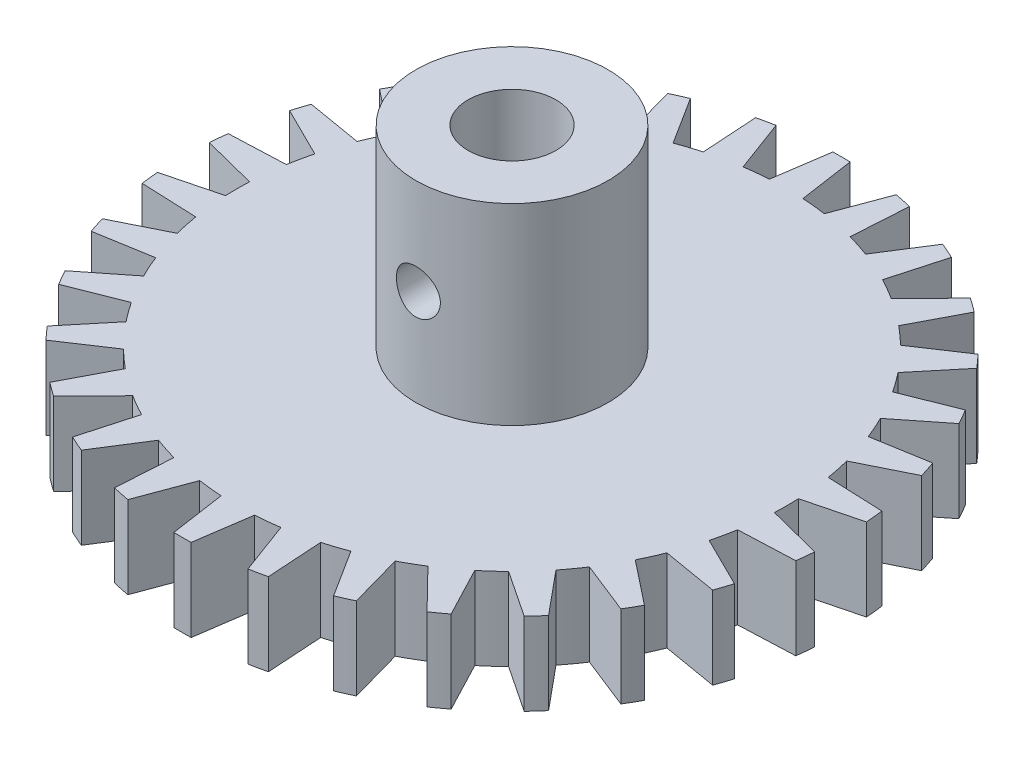
from build123d import *

# Parameters (mm, degrees)
BOSS_EXTRUDE1_DEPTH     = 3
SKETCH3_R               = 3.5
BOSS_EXTRUDE2_DEPTH     = 7
CUT_EXTRUDE1_DEPTH      = 19.333400135
CUT_EXTRUDE1_DEPTH_BACK = 19.333400135
SKETCH2_R               = 1.6
SKETCH4_R               = 0.8
CUT_EXTRUDE2_DEPTH      = 20.675201664


with BuildPart() as part:
    # Sketch1 → Boss-Extrude1 (new body)
    with BuildSketch(Plane(origin=(0, 0, 0), x_dir=(1, 0, 0), z_dir=(0, 1, 0))):
        with BuildLine():
            Line((-0.31412338, 11.9958879), (-0.610485395, 9.981347984))
            ThreePointArc((-0.610485395, 9.981347984), (-0.828082075, 9.965655025), (-1.045284633, 9.945218954))
            ThreePointArc((-1.045284633, 9.945218954), (-1.261989691, 9.920049497), (-1.478094111, 9.890158634))
            Line((-1.478094111, 9.890158634), (-2.186826306, 11.799058891))
            ThreePointArc((-2.186826306, 11.799058891), (-2.49494029, 11.737771209), (-2.801344366, 11.668439045))
            Line((-2.801344366, 11.668439045), (-2.672383761, 9.636304532))
            ThreePointArc((-2.672383761, 9.636304532), (-2.881962681, 9.575713608), (-3.090169944, 9.510565163))
            ThreePointArc((-3.090169944, 9.510565163), (-3.296906453, 9.440890204), (-3.502073813, 9.366721892))
            Line((-3.502073813, 9.366721892), (-4.592201188, 11.08655439))
            ThreePointArc((-4.592201188, 11.08655439), (-4.880839717, 10.962545492), (-5.166133162, 10.831023412))
            Line((-5.166133162, 10.831023412), (-4.617486132, 8.870108332))
            ThreePointArc((-4.617486132, 8.870108332), (-4.809887689, 8.767267557), (-5, 8.660254038))
            ThreePointArc((-5, 8.660254038), (-5.187732582, 8.549118707), (-5.372996083, 8.433914458))
            Line((-5.372996083, 8.433914458), (-6.796874843, 9.889514263))
            ThreePointArc((-6.796874843, 9.889514263), (-7.053423028, 9.708203932), (-7.305137148, 9.520240083))
            Line((-7.305137148, 9.520240083), (-6.360782203, 7.716245834))
            ThreePointArc((-6.360782203, 7.716245834), (-6.527597525, 7.575649844), (-6.691306064, 7.431448255))
            ThreePointArc((-6.691306064, 7.431448255), (-6.851829903, 7.283709699), (-7.009092643, 7.132504492))
            Line((-7.009092643, 7.132504492), (-8.704492452, 8.260254908))
            ThreePointArc((-8.704492452, 8.260254908), (-8.917737906, 8.029567276), (-9.124871587, 7.79337658))
            Line((-9.124871587, 7.79337658), (-7.826081569, 6.225146366))
            ThreePointArc((-7.826081569, 6.225146366), (-7.960020025, 6.05293988), (-8.090169944, 5.877852523))
            ThreePointArc((-8.090169944, 5.877852523), (-8.216469379, 5.699967626), (-8.338858221, 5.519369853))
            Line((-8.338858221, 5.519369853), (-10.231681972, 6.269982777))
            ThreePointArc((-10.231681972, 6.269982777), (-10.392304845, 6), (-10.545805352, 5.725905123))
            Line((-10.545805352, 5.725905123), (-8.949343616, 4.461978131))
            ThreePointArc((-8.949343616, 4.461978131), (-9.044551455, 4.265687399), (-9.135454576, 4.067366431))
            ThreePointArc((-9.135454576, 4.067366431), (-9.222009717, 3.867109616), (-9.30417568, 3.665012267))
            Line((-9.30417568, 3.665012267), (-11.311697893, 4.005682311))
            ThreePointArc((-11.311697893, 4.005682311), (-11.412678196, 3.708203932), (-11.505836818, 3.408184136))
            Line((-11.505836818, 3.408184136), (-9.681476404, 2.503800041))
            ThreePointArc((-9.681476404, 2.503800041), (-9.733792585, 2.292003909), (-9.781476007, 2.079116908))
            ThreePointArc((-9.781476007, 2.079116908), (-9.824503977, 1.86524036), (-9.862856015, 1.650476059))
            Line((-9.862856015, 1.650476059), (-11.897338336, 1.566314307))
            ThreePointArc((-11.897338336, 1.566314307), (-11.934262744, 1.254341559), (-11.963008005, 0.941509149))
            Line((-11.963008005, 0.941509149), (-9.990482216, 0.436193874))
            ThreePointArc((-9.990482216, 0.436193874), (-9.997620271, 0.21814885), (-10, 0))
            ThreePointArc((-10, 0), (-9.997620271, -0.21814885), (-9.990482216, -0.436193874))
            Line((-9.990482216, -0.436193874), (-11.963008005, -0.941509149))
            ThreePointArc((-11.963008005, -0.941509149), (-11.934262744, -1.254341559), (-11.897338336, -1.566314307))
            Line((-11.897338336, -1.566314307), (-9.862856015, -1.650476059))
            ThreePointArc((-9.862856015, -1.650476059), (-9.824503977, -1.86524036), (-9.781476007, -2.079116908))
            ThreePointArc((-9.781476007, -2.079116908), (-9.733792585, -2.292003909), (-9.681476404, -2.503800041))
            Line((-9.681476404, -2.503800041), (-11.505836818, -3.408184136))
            ThreePointArc((-11.505836818, -3.408184136), (-11.412678196, -3.708203932), (-11.311697893, -4.005682311))
            Line((-11.311697893, -4.005682311), (-9.30417568, -3.665012267))
            ThreePointArc((-9.30417568, -3.665012267), (-9.222009717, -3.867109616), (-9.135454576, -4.067366431))
            ThreePointArc((-9.135454576, -4.067366431), (-9.044551455, -4.265687399), (-8.949343616, -4.461978131))
            Line((-8.949343616, -4.461978131), (-10.545805352, -5.725905123))
            ThreePointArc((-10.545805352, -5.725905123), (-10.392304845, -6), (-10.231681972, -6.269982777))
            Line((-10.231681972, -6.269982777), (-8.338858221, -5.519369853))
            ThreePointArc((-8.338858221, -5.519369853), (-8.216469379, -5.699967626), (-8.090169944, -5.877852523))
            ThreePointArc((-8.090169944, -5.877852523), (-7.960020025, -6.05293988), (-7.826081569, -6.225146366))
            Line((-7.826081569, -6.225146366), (-9.124871587, -7.79337658))
            ThreePointArc((-9.124871587, -7.79337658), (-8.917737906, -8.029567276), (-8.704492452, -8.260254908))
            Line((-8.704492452, -8.260254908), (-7.009092643, -7.132504492))
            ThreePointArc((-7.009092643, -7.132504492), (-6.851829903, -7.283709699), (-6.691306064, -7.431448255))
            ThreePointArc((-6.691306064, -7.431448255), (-6.527597525, -7.575649844), (-6.360782203, -7.716245834))
            Line((-6.360782203, -7.716245834), (-7.305137148, -9.520240083))
            ThreePointArc((-7.305137148, -9.520240083), (-7.053423028, -9.708203932), (-6.796874843, -9.889514263))
            Line((-6.796874843, -9.889514263), (-5.372996083, -8.433914458))
            ThreePointArc((-5.372996083, -8.433914458), (-5.187732582, -8.549118707), (-5, -8.660254038))
            ThreePointArc((-5, -8.660254038), (-4.809887689, -8.767267557), (-4.617486132, -8.870108332))
            Line((-4.617486132, -8.870108332), (-5.166133162, -10.831023412))
            ThreePointArc((-5.166133162, -10.831023412), (-4.880839717, -10.962545492), (-4.592201188, -11.08655439))
            Line((-4.592201188, -11.08655439), (-3.502073813, -9.366721892))
            ThreePointArc((-3.502073813, -9.366721892), (-3.296906453, -9.440890204), (-3.090169944, -9.510565163))
            ThreePointArc((-3.090169944, -9.510565163), (-2.881962681, -9.575713608), (-2.672383761, -9.636304532))
            Line((-2.672383761, -9.636304532), (-2.801344366, -11.668439045))
            ThreePointArc((-2.801344366, -11.668439045), (-2.49494029, -11.737771209), (-2.186826306, -11.799058891))
            Line((-2.186826306, -11.799058891), (-1.478094111, -9.890158634))
            ThreePointArc((-1.478094111, -9.890158634), (-1.261989691, -9.920049497), (-1.045284633, -9.945218954))
            ThreePointArc((-1.045284633, -9.945218954), (-0.828082075, -9.965655025), (-0.610485395, -9.981347984))
            Line((-0.610485395, -9.981347984), (-0.31412338, -11.9958879))
            ThreePointArc((-0.31412338, -11.9958879), (0, -12), (0.31412338, -11.9958879))
            Line((0.31412338, -11.9958879), (0.610485395, -9.981347984))
            ThreePointArc((0.610485395, -9.981347984), (0.828082075, -9.965655025), (1.045284633, -9.945218954))
            ThreePointArc((1.045284633, -9.945218954), (1.261989691, -9.920049497), (1.478094111, -9.890158634))
            Line((1.478094111, -9.890158634), (2.186826306, -11.799058891))
            ThreePointArc((2.186826306, -11.799058891), (2.49494029, -11.737771209), (2.801344366, -11.668439045))
            Line((2.801344366, -11.668439045), (2.672383761, -9.636304532))
            ThreePointArc((2.672383761, -9.636304532), (2.881962681, -9.575713608), (3.090169944, -9.510565163))
            ThreePointArc((3.090169944, -9.510565163), (3.296906453, -9.440890204), (3.502073813, -9.366721892))
            Line((3.502073813, -9.366721892), (4.592201188, -11.08655439))
            ThreePointArc((4.592201188, -11.08655439), (4.880839717, -10.962545492), (5.166133162, -10.831023412))
            Line((5.166133162, -10.831023412), (4.617486132, -8.870108332))
            ThreePointArc((4.617486132, -8.870108332), (4.809887689, -8.767267557), (5, -8.660254038))
            ThreePointArc((5, -8.660254038), (5.187732582, -8.549118707), (5.372996083, -8.433914458))
            Line((5.372996083, -8.433914458), (6.796874843, -9.889514263))
            ThreePointArc((6.796874843, -9.889514263), (7.053423028, -9.708203932), (7.305137148, -9.520240083))
            Line((7.305137148, -9.520240083), (6.360782203, -7.716245834))
            ThreePointArc((6.360782203, -7.716245834), (6.527597525, -7.575649844), (6.691306064, -7.431448255))
            ThreePointArc((6.691306064, -7.431448255), (6.851829903, -7.283709699), (7.009092643, -7.132504492))
            Line((7.009092643, -7.132504492), (8.704492452, -8.260254908))
            ThreePointArc((8.704492452, -8.260254908), (8.917737906, -8.029567276), (9.124871587, -7.79337658))
            Line((9.124871587, -7.79337658), (7.826081569, -6.225146366))
            ThreePointArc((7.826081569, -6.225146366), (7.960020025, -6.05293988), (8.090169944, -5.877852523))
            ThreePointArc((8.090169944, -5.877852523), (8.216469379, -5.699967626), (8.338858221, -5.519369853))
            Line((8.338858221, -5.519369853), (10.231681972, -6.269982777))
            ThreePointArc((10.231681972, -6.269982777), (10.392304845, -6), (10.545805352, -5.725905123))
            Line((10.545805352, -5.725905123), (8.949343616, -4.461978131))
            ThreePointArc((8.949343616, -4.461978131), (9.044551455, -4.265687399), (9.135454576, -4.067366431))
            ThreePointArc((9.135454576, -4.067366431), (9.222009717, -3.867109616), (9.30417568, -3.665012267))
            Line((9.30417568, -3.665012267), (11.311697893, -4.005682311))
            ThreePointArc((11.311697893, -4.005682311), (11.412678196, -3.708203932), (11.505836818, -3.408184136))
            Line((11.505836818, -3.408184136), (9.681476404, -2.503800041))
            ThreePointArc((9.681476404, -2.503800041), (9.733792585, -2.292003909), (9.781476007, -2.079116908))
            ThreePointArc((9.781476007, -2.079116908), (9.824503977, -1.86524036), (9.862856015, -1.650476059))
            Line((9.862856015, -1.650476059), (11.897338336, -1.566314307))
            ThreePointArc((11.897338336, -1.566314307), (11.934262744, -1.254341559), (11.963008005, -0.941509149))
            Line((11.963008005, -0.941509149), (9.990482216, -0.436193874))
            ThreePointArc((9.990482216, -0.436193874), (9.997620271, -0.21814885), (10, 0))
            ThreePointArc((10, 0), (9.997620271, 0.21814885), (9.990482216, 0.436193874))
            Line((9.990482216, 0.436193874), (11.963008005, 0.941509149))
            ThreePointArc((11.963008005, 0.941509149), (11.934262744, 1.254341559), (11.897338336, 1.566314307))
            Line((11.897338336, 1.566314307), (9.862856015, 1.650476059))
            ThreePointArc((9.862856015, 1.650476059), (9.824503977, 1.86524036), (9.781476007, 2.079116908))
            ThreePointArc((9.781476007, 2.079116908), (9.733792585, 2.292003909), (9.681476404, 2.503800041))
            Line((9.681476404, 2.503800041), (11.505836818, 3.408184136))
            ThreePointArc((11.505836818, 3.408184136), (11.412678196, 3.708203932), (11.311697893, 4.005682311))
            Line((11.311697893, 4.005682311), (9.30417568, 3.665012267))
            ThreePointArc((9.30417568, 3.665012267), (9.222009717, 3.867109616), (9.135454576, 4.067366431))
            ThreePointArc((9.135454576, 4.067366431), (9.044551455, 4.265687399), (8.949343616, 4.461978131))
            Line((8.949343616, 4.461978131), (10.545805352, 5.725905123))
            ThreePointArc((10.545805352, 5.725905123), (10.392304845, 6), (10.231681972, 6.269982777))
            Line((10.231681972, 6.269982777), (8.338858221, 5.519369853))
            ThreePointArc((8.338858221, 5.519369853), (8.216469379, 5.699967626), (8.090169944, 5.877852523))
            ThreePointArc((8.090169944, 5.877852523), (7.960020025, 6.05293988), (7.826081569, 6.225146366))
            Line((7.826081569, 6.225146366), (9.124871587, 7.79337658))
            ThreePointArc((9.124871587, 7.79337658), (8.917737906, 8.029567276), (8.704492452, 8.260254908))
            Line((8.704492452, 8.260254908), (7.009092643, 7.132504492))
            ThreePointArc((7.009092643, 7.132504492), (6.851829903, 7.283709699), (6.691306064, 7.431448255))
            ThreePointArc((6.691306064, 7.431448255), (6.527597525, 7.575649844), (6.360782203, 7.716245834))
            Line((6.360782203, 7.716245834), (7.305137148, 9.520240083))
            ThreePointArc((7.305137148, 9.520240083), (7.053423028, 9.708203932), (6.796874843, 9.889514263))
            Line((6.796874843, 9.889514263), (5.372996083, 8.433914458))
            ThreePointArc((5.372996083, 8.433914458), (5.187732582, 8.549118707), (5, 8.660254038))
            ThreePointArc((5, 8.660254038), (4.809887689, 8.767267557), (4.617486132, 8.870108332))
            Line((4.617486132, 8.870108332), (5.166133162, 10.831023412))
            ThreePointArc((5.166133162, 10.831023412), (4.880839717, 10.962545492), (4.592201188, 11.08655439))
            Line((4.592201188, 11.08655439), (3.502073813, 9.366721892))
            ThreePointArc((3.502073813, 9.366721892), (3.296906453, 9.440890204), (3.090169944, 9.510565163))
            ThreePointArc((3.090169944, 9.510565163), (2.881962681, 9.575713608), (2.672383761, 9.636304532))
            Line((2.672383761, 9.636304532), (2.801344366, 11.668439045))
            ThreePointArc((2.801344366, 11.668439045), (2.49494029, 11.737771209), (2.186826306, 11.799058891))
            Line((2.186826306, 11.799058891), (1.478094111, 9.890158634))
            ThreePointArc((1.478094111, 9.890158634), (1.261989691, 9.920049497), (1.045284633, 9.945218954))
            ThreePointArc((1.045284633, 9.945218954), (0.828082075, 9.965655025), (0.610485395, 9.981347984))
            Line((0.610485395, 9.981347984), (0.31412338, 11.9958879))
            ThreePointArc((0.31412338, 11.9958879), (0, 12), (-0.31412338, 11.9958879))
        make_face()
    extrude(amount=BOSS_EXTRUDE1_DEPTH)

    # Sketch3 → Boss-Extrude2 (add)
    with BuildSketch(Plane(origin=(0, 3, 0), x_dir=(1, 0, 0), z_dir=(0, 1, 0))):
        Circle(SKETCH3_R)
    extrude(amount=BOSS_EXTRUDE2_DEPTH)

    # Sketch2 → Cut-Extrude1 (cut, two sides: drawn at the far end of the back side and taken through both)
    with BuildSketch(Plane(origin=(0, 3, 0), x_dir=(1, 0, 0), z_dir=(0, 1, 0)).offset(-CUT_EXTRUDE1_DEPTH_BACK)):
        Circle(SKETCH2_R)
    extrude(amount=CUT_EXTRUDE1_DEPTH + CUT_EXTRUDE1_DEPTH_BACK, mode=Mode.SUBTRACT)

    # Sketch4 → Cut-Extrude2 (cut, through all)
    with BuildSketch(Plane.XY):
        with Locations((0, 6.5)):
            Circle(SKETCH4_R)
    extrude(amount=CUT_EXTRUDE2_DEPTH, mode=Mode.SUBTRACT)


solid = part.part
